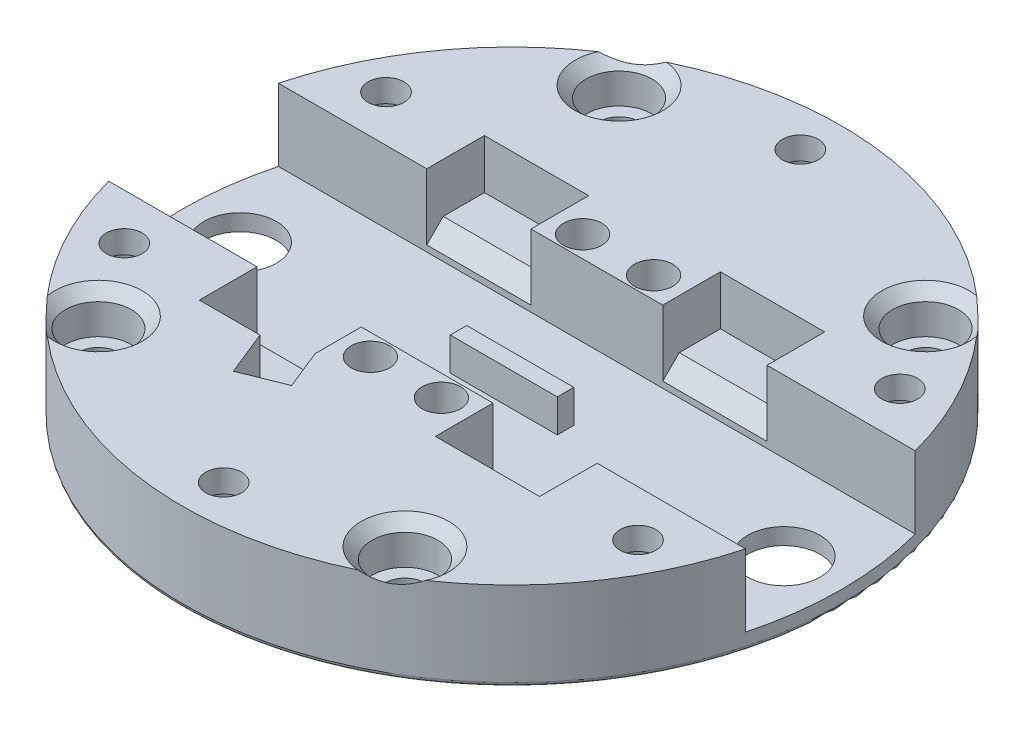
from build123d import *
from build123d.topology import SkipClean

# Parameters (mm, degrees)
SKETCH1_R                                        = 40
BOSS_EXTRUDE1_DEPTH                              = 10.75
CUT_EXTRUDE1_DEPTH                               = 6
CUT_EXTRUDE2_DEPTH                               = 6
SKETCH4_W                                        = 6
SKETCH4_H                                        = 5.601183879
CUT_EXTRUDE3_DEPTH                               = 0.706099456
SKETCH5_W                                        = 5.601183879
SKETCH5_H                                        = 6
CUT_EXTRUDE4_DEPTH                               = 4.589754851
SKETCH6_W                                        = 7
SKETCH6_H                                        = 6
CUT_EXTRUDE5_DEPTH                               = 7.355277629
CUT_EXTRUDE6_REACH                               = 59.241
SKETCH8_W                                        = 12.651131937
SKETCH8_H                                        = 7
CUT_EXTRUDE7_DEPTH                               = 6
BOSS_EXTRUDE2_START                              = 8.75
BOSS_EXTRUDE2_DEPTH                              = 8.75
SKETCH10_W                                       = 12.651131937
SKETCH10_H                                       = 7
CUT_EXTRUDE8_DEPTH                               = 6
SKETCH11_W                                       = 12.651131937
SKETCH11_H                                       = 7
CUT_EXTRUDE9_DEPTH                               = 6
SKETCH12_W                                       = 13
SKETCH12_H                                       = 2
BOSS_EXTRUDE3_DEPTH                              = 4
DRAFT1_ANGLE                                     = 68.007906367
DRAFT2_ANGLE                                     = 21.992093633
M4_CLEARANCE_HOLE1_D                             = 4.66
CBORE_FOR_M4_HEX_HEAD_MACHINE_SCREW1_AT_COUNT    = 2
CBORE_FOR_M4_HEX_HEAD_MACHINE_SCREW1_AT_PITCH    = 43.22206146
CBORE_FOR_M4_HEX_HEAD_MACHINE_SCREW1_2_COUNT     = 2
CBORE_FOR_M4_HEX_HEAD_MACHINE_SCREW1_2_PITCH     = 71
CBORE_FOR_M4_HEX_HEAD_MACHINE_SCREW1_3_COUNT     = 2
CBORE_FOR_M4_HEX_HEAD_MACHINE_SCREW1_3_PITCH     = 56.328087161
F_8_8_8_8_DIAMETER_HOLE1_D                       = 8.8
F_8_8_8_8_DIAMETER_HOLE1_DEPTH                   = 10.75
CBORE_FOR_M4_HEX_HEAD_MACHINE_SCREW2_D           = 4.35
CBORE_FOR_M4_HEX_HEAD_MACHINE_SCREW2_CBORE_D     = 7.8
CBORE_FOR_M4_HEX_HEAD_MACHINE_SCREW2_CBORE_DEPTH = 8
CHAMFER1_SIZE                                    = 2
CHAMFER2_SIZE                                    = 1.5311569
CHAMFER2_SIZE2                                   = 1.474148544
FILLET1_R                                        = 0.5


with BuildPart() as part:
    # Sketch1 → Boss-Extrude1 (new body)
    with BuildSketch(Plane(origin=(0, 10.75, 0), x_dir=(1, 0, 0), z_dir=(0, 1, 0))):
        with Locations(Location((0, 0, 0), (0, 0, 90))):
            Circle(SKETCH1_R)
        Polygon((-13.295854308, -23.598274832), (-13.295854308, -17.3), (-12.589754851, -15.901183879), (5.76268576, -15.901183879), align=None, mode=Mode.SUBTRACT)
    extrude(amount=-BOSS_EXTRUDE1_DEPTH)

    # Sketch2 → Cut-Extrude1 (cut)
    with BuildSketch(Plane(origin=(0, 10.75, 0), x_dir=(-1, 0, 0), z_dir=(0, 1, 0))):
        Polygon((12.589754851, 15.901183879), (13.295854308, 15.901183879), (13.295854308, 17.3), align=None)
    extrude(amount=-CUT_EXTRUDE1_DEPTH, mode=Mode.SUBTRACT)

    # Sketch3 → Cut-Extrude2 (cut)
    with BuildSketch(Plane(origin=(0, 10.75, 0), x_dir=(-1, 0, 0), z_dir=(0, 1, 0))):
        with BuildLine():
            Line((38.651131937, 10.3), (-38.651131937, 10.3))
            ThreePointArc((-38.651131937, 10.3), (0, -40), (38.651131937, 10.3))
        make_face()
    extrude(amount=-CUT_EXTRUDE2_DEPTH, mode=Mode.SUBTRACT)

    # Sketch4 → Cut-Extrude3 (cut)
    with BuildSketch(Plane(origin=(-13.295854308, 0, 0), x_dir=(0, -1, 0), z_dir=(-1, 0, 0))):
        with Locations((-7.75, 13.10059194)):
            Rectangle(SKETCH4_W, SKETCH4_H)
    extrude(amount=-CUT_EXTRUDE3_DEPTH, mode=Mode.SUBTRACT)

    # Sketch5 → Cut-Extrude4 (cut)
    with BuildSketch(Plane.ZY.offset(12.589754851)):
        with Locations((13.10059194, 7.75)):
            Rectangle(SKETCH5_W, SKETCH5_H)
    extrude(amount=-CUT_EXTRUDE4_DEPTH, mode=Mode.SUBTRACT)

    # Sketch6 → Cut-Extrude5 (cut)
    with BuildSketch(Plane(origin=(-13.295854308, 0, 0), x_dir=(0, 0, -1), z_dir=(1, 0, 0))):
        with Locations((-13.8, 7.75)):
            Rectangle(SKETCH6_W, SKETCH6_H)
    extrude(amount=-CUT_EXTRUDE5_DEPTH, mode=Mode.SUBTRACT)

    # Sketch7 → Cut-Extrude6 (cut, up to next)
    with BuildSketch(Plane.XZ.offset(-2), mode=Mode.PRIVATE) as cut_extrude6_sk1:
        with BuildLine():
            Line((38.651131937, 10.3), (-38.651131937, 10.3))
            ThreePointArc((-38.651131937, 10.3), (0, -40), (38.651131937, 10.3))
        make_face()
    cut_extrude6_tool1 = extrude(cut_extrude6_sk1.sketch, amount=-CUT_EXTRUDE6_REACH, mode=Mode.PRIVATE) & part.part
    add(cut_extrude6_tool1.solids().sort_by_distance((0, 2, -11.566508))[0], mode=Mode.SUBTRACT)

    # Sketch8 → Cut-Extrude7 (cut)
    with BuildSketch(Plane(origin=(0, 10.75, 0), x_dir=(-1, 0, 0), z_dir=(0, 1, 0))):
        with Locations((-14.325565969, 13.8)):
            Rectangle(SKETCH8_W, SKETCH8_H)
    extrude(amount=-CUT_EXTRUDE7_DEPTH, mode=Mode.SUBTRACT)

    # Sketch9 → Boss-Extrude2 (add)
    with SkipClean():  # the faces are left unmerged after this step: merging them gives an invalid solid
        with BuildSketch(Plane(origin=(0, 2, 0), x_dir=(-1, 0, 0), z_dir=(0, 1, 0)).offset(BOSS_EXTRUDE2_START)):
            with BuildLine():
                Line((-38.651131937, -10.3), (38.651131937, -10.3))
                ThreePointArc((38.651131937, -10.3), (0, -40), (-38.651131937, -10.3))
            make_face()
        extrude(amount=-BOSS_EXTRUDE2_DEPTH)
    add(part.part.scale(1), mode=Mode.REPLACE)  # the faces are merged on a copy

    # Sketch10 → Cut-Extrude8 (cut)
    with BuildSketch(Plane(origin=(0, 10.75, 0), x_dir=(-1, 0, 0), z_dir=(0, 1, 0))):
        with Locations((-14.325565969, -13.8)):
            Rectangle(SKETCH10_W, SKETCH10_H)
    extrude(amount=-CUT_EXTRUDE8_DEPTH, mode=Mode.SUBTRACT)

    # Sketch11 → Cut-Extrude9 (cut)
    with BuildSketch(Plane(origin=(0, 10.75, 0), x_dir=(-1, 0, 0), z_dir=(0, 1, 0))):
        with Locations((14.325565969, -13.8)):
            Rectangle(SKETCH11_W, SKETCH11_H)
    extrude(amount=-CUT_EXTRUDE9_DEPTH, mode=Mode.SUBTRACT)

    # Sketch12 → Boss-Extrude3 (add)
    with BuildSketch(Plane(origin=(0, 2, 0), x_dir=(-1, 0, 0), z_dir=(0, 1, 0))):
        Rectangle(SKETCH12_W, SKETCH12_H)
    extrude(amount=BOSS_EXTRUDE3_DEPTH)

    # Draft1
    draft1_faces = [part.faces().sort_by_distance(p)[0] for p in [
        (-2.297176197, 4.989704408, 15.901183879),
    ]]
    draft(draft1_faces, Plane(origin=(-8, 0, 0), x_dir=(0, 0, -1), z_dir=(-1, 0, 0)), DRAFT1_ANGLE)

    # Draft2
    draft2_faces = [part.faces().sort_by_distance(p)[0] for p in [
        (-13.295854308, 5.375, 20.449137416),
    ]]
    draft(draft2_faces, Plane(origin=(-20.651131937, 10.75, 17.3), x_dir=(-1, 0, 0), z_dir=(0, 0, -1)), DRAFT2_ANGLE)

    # M4 Clearance Hole1 (through all)
    with Locations(Plane(origin=(0, 0, 0), x_dir=(-1, 0, 0), z_dir=(0, -1, 0))):
        with Locations((-4.307478356, -12.879228634), (4.307478356, 12.879228634), (-4.307478356, 12.879228634), (4.307478356, -12.879228634)):
            Hole(M4_CLEARANCE_HOLE1_D / 2)

    # Sketch15 → CBORE for M4 Hex Head Machine Screw1 (revolve, cut)
    with BuildSketch(Plane(origin=(25.102290732, 10.75, -25.102290732), x_dir=(0, 0, 1), z_dir=(1, 0, 0))):
        Polygon((0, 0), (0, 10.75), (2.4, 10.75), (2.4, 5), (4, 5), (4, 1.32), (5.32, 0), align=None)
    cbore_for_m4_hex_head_machine_screw1 = revolve(axis=Axis((25.102290732, 17.1, -25.102290732), (0, -1, 0)), mode=Mode.SUBTRACT)

    # CBORE for M4 Hex Head Machine Screw1 at: CBORE for M4 Hex Head Machine Screw1 ×2
    with Locations(*[Vector(-0.9914448613738109, 0, -0.13052619222004783) * (i * CBORE_FOR_M4_HEX_HEAD_MACHINE_SCREW1_AT_PITCH) for i in range(1, CBORE_FOR_M4_HEX_HEAD_MACHINE_SCREW1_AT_COUNT)]):
        add(cbore_for_m4_hex_head_machine_screw1, mode=Mode.SUBTRACT)

    # CBORE for M4 Hex Head Machine Screw1 2: CBORE for M4 Hex Head Machine Screw1 ×2
    with Locations(*[Vector(-0.7071067811865434, 0, 0.7071067811865517) * (i * CBORE_FOR_M4_HEX_HEAD_MACHINE_SCREW1_2_PITCH) for i in range(1, CBORE_FOR_M4_HEX_HEAD_MACHINE_SCREW1_2_COUNT)]):
        add(cbore_for_m4_hex_head_machine_screw1, mode=Mode.SUBTRACT)

    # CBORE for M4 Hex Head Machine Screw1 3: CBORE for M4 Hex Head Machine Screw1 ×2
    with Locations(*[Vector(-0.13052619222004894, 0, 0.9914448613738108) * (i * CBORE_FOR_M4_HEX_HEAD_MACHINE_SCREW1_3_PITCH) for i in range(1, CBORE_FOR_M4_HEX_HEAD_MACHINE_SCREW1_3_COUNT)]):
        add(cbore_for_m4_hex_head_machine_screw1, mode=Mode.SUBTRACT)

    # Ø8.8 (8.8) Diameter Hole1
    with Locations(Plane(origin=(0, 0, 0), x_dir=(-1, 0, 0), z_dir=(0, -1, 0))):
        with Locations((33, 0), (-33, 0)):
            Hole(F_8_8_8_8_DIAMETER_HOLE1_D / 2, depth=F_8_8_8_8_DIAMETER_HOLE1_DEPTH)

    # CBORE for M4 Hex Head Machine Screw2 (through all)
    with Locations(Plane(origin=(0, 0, 0), x_dir=(-1, 0, 0), z_dir=(0, -1, 0))):
        with Locations((31.185228347, -15.889667491), (0, -35), (-31.185228347, -15.889667491), (31.185228347, 15.889667491), (0, 35), (-31.185228347, 15.889667491)):
            CounterBoreHole(CBORE_FOR_M4_HEX_HEAD_MACHINE_SCREW2_D / 2, CBORE_FOR_M4_HEX_HEAD_MACHINE_SCREW2_CBORE_D / 2, CBORE_FOR_M4_HEX_HEAD_MACHINE_SCREW2_CBORE_DEPTH)

    # Chamfer1
    # the kernel refuses this chamfer: 2 mm, written as the material it takes off along each edge
    with BuildSketch(Plane(origin=(8, 4.75, -10.3), x_dir=(0, -0.9996219169112968, 0.027495876610586473), z_dir=(1, 0, 0)), Plane(origin=(-20.651131937, 4.75, -10.3), x_dir=(0, -0.9996219169112968, 0.027495876610586473), z_dir=(1, 0, 0)), Plane(origin=(-8, 4.75, 10.3), x_dir=(0, -0.9996219169112968, -0.027495876610586462), z_dir=(-1, 0, 0)), Plane(origin=(20.651131937, 4.75, 10.3), x_dir=(0, -0.9996219169112968, -0.027495876610586473), z_dir=(-1, 0, 0))) as chamfer1_piece_1:
        Polygon((CHAMFER1_SIZE * 0.999621916911, CHAMFER1_SIZE * 0.0274958766106), (-CHAMFER1_SIZE * 0.0274958766106, CHAMFER1_SIZE * 0.999621916911), (0, 0), align=None)
    extrude(amount=12.651131937, mode=Mode.SUBTRACT)

    # Chamfer2
    chamfer2_edges = [part.edges().sort_by_distance(p)[0] for p in [
        (-10.04, 1.65, 10.85),
    ]]
    chamfer2_side = [part.faces().sort_by_distance(p)[0] for p in [
        (-11.717101205, 2.307785852, 14.1724161),
    ]]
    chamfer(chamfer2_edges, length=CHAMFER2_SIZE, length2=CHAMFER2_SIZE2, reference=chamfer2_side[0])

    # Fillet1
    fillet1_edges = [part.edges().sort_by_distance(p)[0] for p in [
        (0, 0, 40),
    ]]
    fillet(fillet1_edges, radius=FILLET1_R)


solid = part.part
